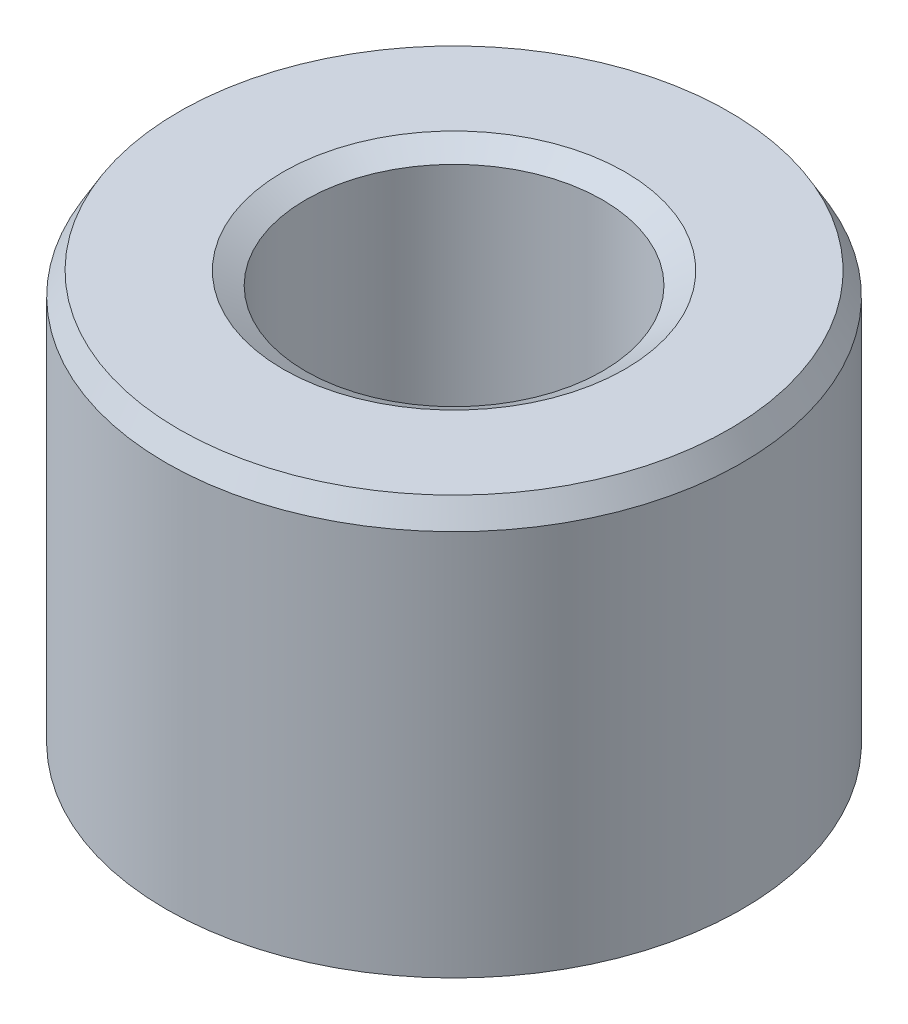
from build123d import *
from OCP.BRepFilletAPI import BRepFilletAPI_MakeChamfer

# Parameters (mm, degrees)
SKETCH1_R           = 37.5
BOSS_EXTRUDE1_DEPTH = 54.930536533
SKETCH2_R           = 19.323172
CUT_EXTRUDE1_DEPTH  = 77.353545064
CHAMFER1_SIZE       = 2.926669412
CHAMFER1_SIZE2      = 1.689713373


with BuildPart() as part:
    # Sketch1 → Boss-Extrude1 (new body)
    with BuildSketch(Plane(origin=(0, 0, 0), x_dir=(1, 0, 0), z_dir=(0, 1, 0))):
        Circle(SKETCH1_R)
    extrude(amount=BOSS_EXTRUDE1_DEPTH)

    # Sketch2 → Cut-Extrude1 (cut, through all)
    with BuildSketch(Plane(origin=(0, 0, 0), x_dir=(1, 0, 0), z_dir=(0, 1, 0))):
        Circle(SKETCH2_R)
    extrude(amount=CUT_EXTRUDE1_DEPTH, mode=Mode.SUBTRACT)

    # Chamfer1: one chamfer whose edges measure the first distance from different faces: ONE call of the kernel's chamfer builder (chamfer() names one face for all edges)
    chamfer1_edges_1 = [part.edges().sort_by_distance(p)[0] for p in [
        (-19.323172, 54.930536533, 0),
    ]]
    chamfer1_side_1 = [part.faces().sort_by_distance(p)[0] for p in [
        (-36.439339828, 54.930536533, 0),
    ]]
    chamfer1_edges_2 = [part.edges().sort_by_distance(p)[0] for p in [
        (-19.323172, 0, 0),
    ]]
    chamfer1_side_2 = [part.faces().sort_by_distance(p)[0] for p in [
        (-19.323172, 27.465268267, 0),
    ]]
    chamfer1_edges_3 = [part.edges().sort_by_distance(p)[0] for p in [
        (-37.5, 0, 0),
    ]]
    chamfer1_side_3 = [part.faces().sort_by_distance(p)[0] for p in [
        (-36.439339828, 0, 0),
    ]]
    chamfer1_edges_4 = [part.edges().sort_by_distance(p)[0] for p in [
        (-37.5, 54.930536533, 0),
    ]]
    chamfer1_side_4 = [part.faces().sort_by_distance(p)[0] for p in [
        (-37.5, 27.465268267, 0),
    ]]
    chamfer1 = BRepFilletAPI_MakeChamfer(part.part.solid().wrapped)
    for e in chamfer1_edges_1:
        chamfer1.Add(CHAMFER1_SIZE, CHAMFER1_SIZE2, e.wrapped, chamfer1_side_1[0].wrapped)  # the first distance lies on this face
    for e in chamfer1_edges_2:
        chamfer1.Add(CHAMFER1_SIZE, CHAMFER1_SIZE2, e.wrapped, chamfer1_side_2[0].wrapped)  # the first distance lies on this face
    for e in chamfer1_edges_3:
        chamfer1.Add(CHAMFER1_SIZE, CHAMFER1_SIZE2, e.wrapped, chamfer1_side_3[0].wrapped)  # the first distance lies on this face
    for e in chamfer1_edges_4:
        chamfer1.Add(CHAMFER1_SIZE, CHAMFER1_SIZE2, e.wrapped, chamfer1_side_4[0].wrapped)  # the first distance lies on this face
    add(Compound.cast(chamfer1.Shape()), mode=Mode.REPLACE)


solid = part.part
